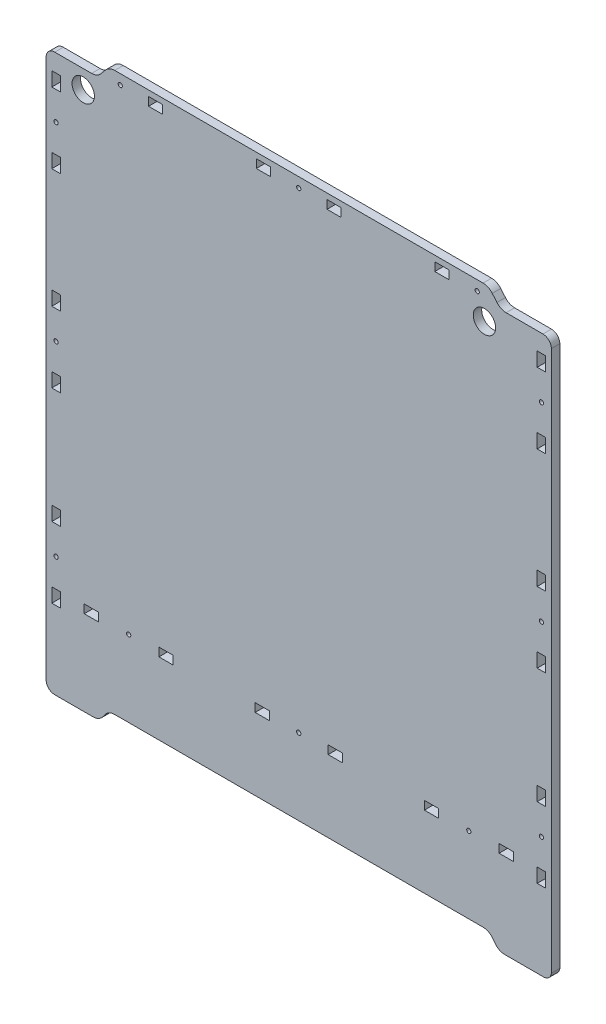
from build123d import *

# Parameters (mm, degrees)
SKETCH_1_R      = 1.5
SKETCH_1_R_2    = 7.9
SKETCH_1_W      = 6
SKETCH_1_H      = 10
SKETCH_1_W_2    = 10
SKETCH_1_H_2    = 6
EXTRUDE_1_DEPTH = 6


with BuildPart() as part:
    # Эскиз1 → Бобышка-Вытянуть1 (new body)
    with BuildSketch(Plane.XY):
        with BuildLine():
            Line((146.861398458, 191.532325026), (172.897783364, 191.532325026))
            ThreePointArc((172.897783364, 191.532325026), (177.076317747, 189.745999648), (178.804179186, 185.542952802))
            Line((178.804179186, 185.542952802), (178.804179186, -196.675834418))
            ThreePointArc((178.804179186, -196.675834418), (176.892140189, -200.429470569), (172.897783364, -201.767674974))
            Line((172.897783364, -201.767674974), (145.861398458, -201.767674974))
            ThreePointArc((145.861398458, -201.767674974), (142.269143233, -200.971291164), (139.350020692, -198.731369657))
            Line((139.350020692, -198.731369657), (137.054194639, -195.711716561))
            ThreePointArc((137.054194639, -195.711716561), (134.135072097, -193.471795054), (130.542816872, -192.675411244))
            Line((130.542816872, -192.675411244), (-129.747250144, -192.675411244))
            ThreePointArc((-129.747250144, -192.675411244), (-133.339505369, -193.471795054), (-136.258627911, -195.711716561))
            Line((-136.258627911, -195.711716561), (-138.554453964, -198.731369657))
            ThreePointArc((-138.554453964, -198.731369657), (-141.473576506, -200.971291164), (-145.06583173, -201.767674974))
            Line((-145.06583173, -201.767674974), (-172.102216636, -201.767674974))
            ThreePointArc((-172.102216636, -201.767674974), (-176.405497525, -200.043755719), (-178.195820814, -195.767674974))
            Line((-178.195820814, -195.767674974), (-178.195820814, 185.542952802))
            ThreePointArc((-178.195820814, 185.542952802), (-176.401714686, 189.812135315), (-172.102216636, 191.532325026))
            Line((-172.102216636, 191.532325026), (-146.06583173, 191.532325026))
            ThreePointArc((-146.06583173, 191.532325026), (-142.473576506, 192.328708836), (-139.554453964, 194.568630343))
            Line((-139.554453964, 194.568630343), (-136.258627911, 198.496442883))
            ThreePointArc((-136.258627911, 198.496442883), (-133.339449219, 200.73613298), (-129.747250144, 201.532325026))
            Line((-129.747250144, 201.532325026), (130.542816872, 201.532325026))
            ThreePointArc((130.542816872, 201.532325026), (134.135072097, 200.735941215), (137.054194639, 198.496019708))
            Line((137.054194639, 198.496019708), (140.350020692, 194.568207169))
            ThreePointArc((140.350020692, 194.568207169), (143.269199383, 192.328517071), (146.861398458, 191.532325026))
        make_face()
        with Locations((120.494179186, -138.767674974)):
            Circle(SKETCH_1_R, mode=Mode.SUBTRACT)
        with Locations((0.304179186, -138.767674974)):
            Circle(SKETCH_1_R, mode=Mode.SUBTRACT)
        with Locations((-119.885820814, -138.767674974)):
            Circle(SKETCH_1_R, mode=Mode.SUBTRACT)
        with Locations((-171.195820814, -116.737674974)):
            Circle(SKETCH_1_R, mode=Mode.SUBTRACT)
        with Locations((-171.195820814, 14.972325026)):
            Circle(SKETCH_1_R, mode=Mode.SUBTRACT)
        with Locations((171.804179186, 149.132325026)):
            Circle(SKETCH_1_R, mode=Mode.SUBTRACT)
        with Locations((126.444179186, 194.532325026)):
            Circle(SKETCH_1_R, mode=Mode.SUBTRACT)
        with Locations((-151.995820814, 178.532325026)):
            Circle(SKETCH_1_R_2, mode=Mode.SUBTRACT)
        with Locations((171.804179186, -116.737674974)):
            Circle(SKETCH_1_R, mode=Mode.SUBTRACT)
        with Locations((171.804179186, 14.972325026)):
            Circle(SKETCH_1_R, mode=Mode.SUBTRACT)
        with Locations((-171.195820814, 149.132325026)):
            Circle(SKETCH_1_R, mode=Mode.SUBTRACT)
        with Locations((-125.835820814, 194.532325026)):
            Circle(SKETCH_1_R, mode=Mode.SUBTRACT)
        with Locations((0.304179186, 194.54440539)):
            Circle(SKETCH_1_R, mode=Mode.SUBTRACT)
        with Locations((131.504179186, 178.532325026)):
            Circle(SKETCH_1_R_2, mode=Mode.SUBTRACT)
        with Locations((-171.195820814, 39.972325026)):
            Rectangle(SKETCH_1_W, SKETCH_1_H, mode=Mode.SUBTRACT)
        with Locations((171.804179186, 39.972325026)):
            Rectangle(SKETCH_1_W, SKETCH_1_H, mode=Mode.SUBTRACT)
        Polygon((174.804179186, 179.132325026), (174.804179186, 169.359038573), (174.804179186, 169.132325026), (168.804179186, 169.132325026), (168.804179186, 179.132325026), align=None, mode=Mode.SUBTRACT)
        Polygon((96.444179186, 197.532325026), (106.41988356, 197.532325026), (106.444179186, 197.514906712), (106.444179186, 191.332537312), (106.419882773, 191.532325026), (96.444179186, 191.532325026), align=None, mode=Mode.SUBTRACT)
        with Locations((26.094179186, -138.767674974)):
            Rectangle(SKETCH_1_W_2, SKETCH_1_H_2, mode=Mode.SUBTRACT)
        with Locations((-25.485820814, -138.767674974)):
            Rectangle(SKETCH_1_W_2, SKETCH_1_H_2, mode=Mode.SUBTRACT)
        with Locations((-171.195820814, 174.132325026)):
            Rectangle(SKETCH_1_W, SKETCH_1_H, mode=Mode.SUBTRACT)
        with Locations((94.094179186, -138.767674974)):
            Rectangle(SKETCH_1_W_2, SKETCH_1_H_2, mode=Mode.SUBTRACT)
        with Locations((146.894179186, -138.767674974)):
            Rectangle(SKETCH_1_W_2, SKETCH_1_H_2, mode=Mode.SUBTRACT)
        Polygon((-19.68524425, 191.532325026), (-29.685244433, 191.532325026), (-29.686393667, 197.532325026), (-19.686393484, 197.532325026), align=None, mode=Mode.SUBTRACT)
        with Locations((-171.195820814, 124.132325026)):
            Rectangle(SKETCH_1_W, SKETCH_1_H, mode=Mode.SUBTRACT)
        with Locations((-146.285820814, -138.767674974)):
            Rectangle(SKETCH_1_W_2, SKETCH_1_H_2, mode=Mode.SUBTRACT)
        with Locations((25.294179186, 194.532325026)):
            Rectangle(SKETCH_1_W_2, SKETCH_1_H_2, mode=Mode.SUBTRACT)
        with Locations((-171.195820814, -10.027674974)):
            Rectangle(SKETCH_1_W, SKETCH_1_H, mode=Mode.SUBTRACT)
        with Locations((-171.195820814, -91.757674974)):
            Rectangle(SKETCH_1_W, SKETCH_1_H, mode=Mode.SUBTRACT)
        with Locations((-171.195820814, -141.747674974)):
            Rectangle(SKETCH_1_W, SKETCH_1_H, mode=Mode.SUBTRACT)
        with Locations((-93.485820814, -138.767674974)):
            Rectangle(SKETCH_1_W_2, SKETCH_1_H_2, mode=Mode.SUBTRACT)
        with Locations((171.804179186, -10.027674974)):
            Rectangle(SKETCH_1_W, SKETCH_1_H, mode=Mode.SUBTRACT)
        with Locations((171.804179186, -91.757674974)):
            Rectangle(SKETCH_1_W, SKETCH_1_H, mode=Mode.SUBTRACT)
        with Locations((171.804179186, -141.747674974)):
            Rectangle(SKETCH_1_W, SKETCH_1_H, mode=Mode.SUBTRACT)
        with Locations((171.804179186, 124.132325026)):
            Rectangle(SKETCH_1_W, SKETCH_1_H, mode=Mode.SUBTRACT)
        Polygon((-95.835245647, 191.532325026), (-105.83524583, 191.532325026), (-105.836395064, 197.532325026), (-95.836394881, 197.532325026), align=None, mode=Mode.SUBTRACT)
    extrude(amount=EXTRUDE_1_DEPTH)


solid = part.part
